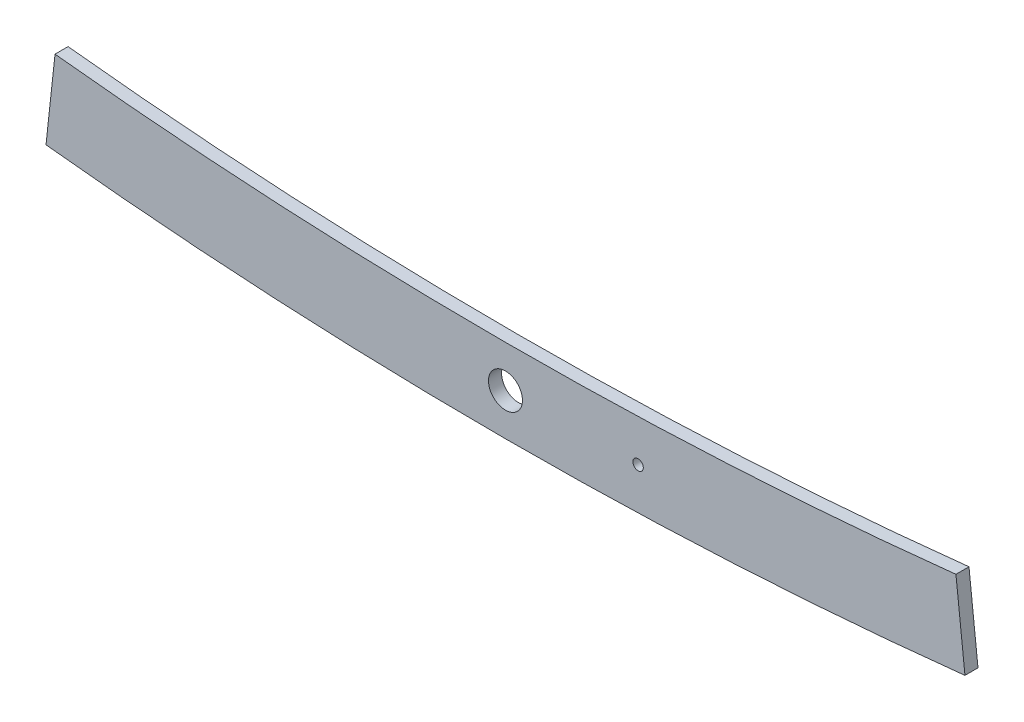
from build123d import *

# Parameters (mm, degrees)
BOSS_EXTRUDE1_DEPTH = 1.25
SKETCH2_R           = 3.25
CUT_EXTRUDE1_DEPTH  = 10
SKETCH3_R           = 1
CUT_EXTRUDE2_DEPTH  = 10


with BuildPart() as part:
    # Sketch1 → Boss-Extrude1 (new, symmetric)
    with BuildSketch(Plane.XY):
        with BuildLine():
            Line((88, 4.758975396), (86.274509804, 20.665662153))
            ThreePointArc((86.274509804, 20.665662153), (0, 16), (-86.274509804, 20.665662153))
            Line((-86.274509804, 20.665662153), (-88, 4.758975396))
            ThreePointArc((-88, 4.758975396), (0, 0), (88, 4.758975396))
        make_face()
    extrude(amount=BOSS_EXTRUDE1_DEPTH, both=True)

    # Sketch2 → Cut-Extrude1 (cut, symmetric)
    with BuildSketch(Plane.XY):
        with Locations((0, 8)):
            Circle(SKETCH2_R)
    extrude(amount=CUT_EXTRUDE1_DEPTH, both=True, mode=Mode.SUBTRACT)

    # Sketch3 → Cut-Extrude2 (cut, symmetric)
    with BuildSketch(Plane.XY):
        with Locations((25.4, 8.399370551)):
            Circle(SKETCH3_R)
    extrude(amount=CUT_EXTRUDE2_DEPTH, both=True, mode=Mode.SUBTRACT)


solid = part.part
